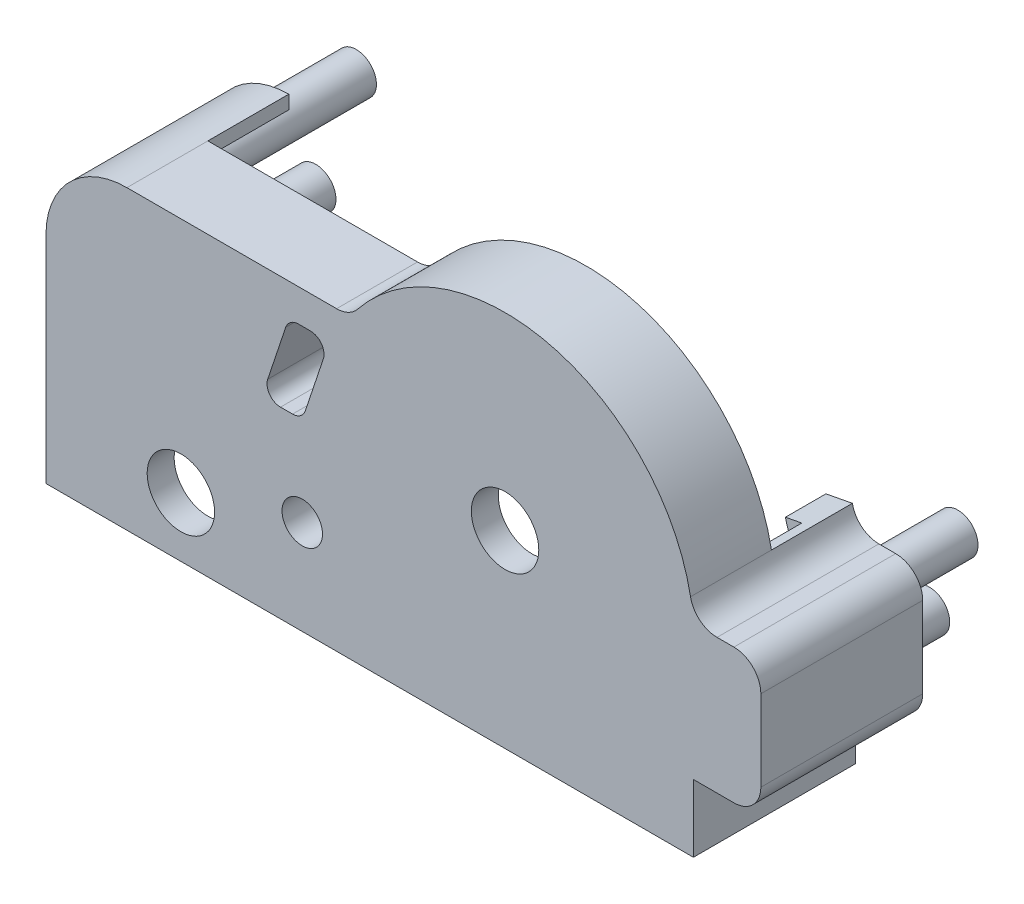
from build123d import *
from build123d.topology import SkipClean

# Parameters (mm, degrees)
BOSS_EXTRUDE1_DEPTH = 6
SHELL1_DEPTH        = 5
SKETCH2_R           = 1.25
SKETCH2_R_2         = 0.75
CUT_EXTRUDE1_DEPTH  = 6
SKETCH3_W           = 11.178272445
SKETCH3_H           = 3
BOSS_EXTRUDE2_DEPTH = 1
CUT_EXTRUDE2_DEPTH  = 3
BOSS_EXTRUDE4_START = 2
SKETCH7_R           = 7
SKETCH7_R_2         = 6
BOSS_EXTRUDE4_DEPTH = 2
BOSS_EXTRUDE5_START = 2
SKETCH8_R           = 1.55
SKETCH8_R_2         = 0.75
BOSS_EXTRUDE5_DEPTH = 2
SKETCH10_R          = 0.75
BOSS_EXTRUDE6_DEPTH = 8
SKETCH17_W          = 11.178272445
SKETCH17_H          = 1
CUT_EXTRUDE5_DEPTH  = 1
SKETCH18_W          = 2.5
SKETCH18_H          = 2
SKETCH18_W_2        = 2
SKETCH18_H_2        = 2.5
CUT_EXTRUDE7_DEPTH  = 3.5


# Read off the part's stored shape, not the designer's step: Shell1
with BuildPart() as part:
    # Sketch1 → Boss-Extrude1 (new body)
    with BuildSketch(Plane.XY):
        with BuildLine():
            Line((-17.017879978, -7), (6.982120022, -7))
            Line((6.982120022, -7), (6.982120022, -4.5))
            Line((6.982120022, -4.5), (8.482120022, -4.5))
            ThreePointArc((8.482120022, -4.5), (9.189226803, -4.207106781), (9.482120022, -3.5))
            Line((9.482120022, -3.5), (9.482120022, -0.5))
            ThreePointArc((9.482120022, -0.5), (9.189226803, 0.207106781), (8.482120022, 0.5))
            Line((8.482120022, 0.5), (7.858116823, 0.5))
            ThreePointArc((7.858116823, 0.5), (7.220739384, 0.72944825), (6.87585222, 1.3125))
            ThreePointArc((6.87585222, 1.3125), (1.68605895, 6.793909421), (-5.464373249, 4.375))
            ThreePointArc((-5.464373249, 4.375), (-5.811985297, 4.098612181), (-6.244997998, 4))
            Line((-6.244997998, 4), (-14.017879978, 4))
            ThreePointArc((-14.017879978, 4), (-16.139200322, 3.121320344), (-17.017879978, 1))
            Line((-17.017879978, 1), (-17.017879978, -7))
        make_face()
    extrude(amount=BOSS_EXTRUDE1_DEPTH)

    # Shell1 outline → Shell1 (cut)
    with BuildSketch(Plane.XY):
        with BuildLine():
            Line((-16.017879978, 1), (-16.017879978, -7))
            Line((-16.017879978, -7), (5.982120022, -7))
            Line((5.982120022, -7), (5.982120022, -3.5))
            Line((5.982120022, -3.5), (8.482120022, -3.5))
            Line((8.482120022, -3.5), (8.482120022, -0.5))
            Line((8.482120022, -0.5), (7.858116823, -0.5))
            ThreePointArc((7.858116823, -0.5), (6.583361944, -0.041103501), (5.893587617, 1.125))
            ThreePointArc((5.893587617, 1.125), (1.445193386, 5.823350932), (-4.683748499, 3.75))
            ThreePointArc((-4.683748499, 3.75), (-5.378972594, 3.197224362), (-6.244997998, 3))
            Line((-6.244997998, 3), (-14.017879978, 3))
            ThreePointArc((-14.017879978, 3), (-15.43209354, 2.414213562), (-16.017879978, 1))
        make_face()
    extrude(amount=SHELL1_DEPTH, mode=Mode.SUBTRACT)

    # Sketch2 → Cut-Extrude1 (cut)
    with BuildSketch(Plane(origin=(0, 0, 5), x_dir=(-1, 0, 0), z_dir=(0, 0, -1))):
        Circle(SKETCH2_R)
        with Locations((7.517879978, -3.5)):
            Circle(SKETCH2_R_2)
        with Locations((12.017879978, -4.796605976)):
            Circle(SKETCH2_R)
        with BuildLine():
            Line((7.211592921, 2.8), (7.657500368, 2.8))
            ThreePointArc((7.657500368, 2.8), (7.94985551, 2.705621093), (8.131842017, 2.458113883))
            Line((8.131842017, 2.458113883), (8.798508684, 0.458113883))
            ThreePointArc((8.798508684, 0.458113883), (8.729788127, 0.007644858), (8.324167035, -0.2))
            Line((8.324167035, -0.2), (7.878259588, -0.2))
            ThreePointArc((7.878259588, -0.2), (7.585904446, -0.105621093), (7.403917939, 0.141886117))
            Line((7.403917939, 0.141886117), (6.737251272, 2.141886117))
            ThreePointArc((6.737251272, 2.141886117), (6.805971829, 2.592355142), (7.211592921, 2.8))
        make_face()
    extrude(amount=-CUT_EXTRUDE1_DEPTH, mode=Mode.SUBTRACT)

    # Sketch3 → Boss-Extrude2 (add)
    with BuildSketch(Plane.XZ.offset(7)):
        with Locations((0.3929838, 3.5)):
            Rectangle(SKETCH3_W, SKETCH3_H)
    extrude(amount=-BOSS_EXTRUDE2_DEPTH)

    # Sketch6 → Cut-Extrude2 (cut)
    with BuildSketch(Plane(origin=(0, 0, 0), x_dir=(-1, 0, 0), z_dir=(0, 0, -1))):
        with BuildLine():
            Line((6.244997998, 4), (14.017879978, 4))
            Line((14.017879978, 4), (14.017879978, 3))
            Line((14.017879978, 3), (6.244997998, 3))
            ThreePointArc((6.244997998, 3), (5.378972595, 3.197224362), (4.683748499, 3.75))
            ThreePointArc((4.683748499, 3.75), (-1.445193386, 5.823350932), (-5.893587617, 1.125))
            Line((-5.893587617, 1.125), (-6.87585222, 1.3125))
            ThreePointArc((-6.87585222, 1.3125), (-1.68605895, 6.793909421), (5.464373249, 4.375))
            ThreePointArc((5.464373249, 4.375), (5.811985297, 4.098612181), (6.244997998, 4))
        make_face()
    extrude(amount=-CUT_EXTRUDE2_DEPTH, mode=Mode.SUBTRACT)

    # Sketch7 → Boss-Extrude4 (add)
    with SkipClean():  # the faces are left unmerged after this step: merging them gives an invalid solid
        with BuildSketch(Plane(origin=(0, 0, 5), x_dir=(-1, 0, 0), z_dir=(0, 0, -1)).offset(BOSS_EXTRUDE4_START)):
            Circle(SKETCH7_R)
            with Locations(Location((0, 0, 0), (0, 0, 270))):
                Circle(SKETCH7_R_2, mode=Mode.SUBTRACT)
        extrude(amount=-BOSS_EXTRUDE4_DEPTH)

    # Sketch8 → Boss-Extrude5 (add)
    # profile 1 of 2: a face of its own
    with SkipClean():  # the faces are left unmerged after this step: merging them gives an invalid solid
        with BuildSketch(Plane(origin=(0, 0, 5), x_dir=(-1, 0, 0), z_dir=(0, 0, -1)).offset(BOSS_EXTRUDE5_START)):
            with Locations((7.517879978, -3.5)):
                Circle(SKETCH8_R)
            with Locations((7.517879978, -3.5)):
                Circle(SKETCH8_R_2, mode=Mode.SUBTRACT)
        # profile 2 of 2: a face of its own
        with BuildSketch(Plane(origin=(0, 0, 5), x_dir=(-1, 0, 0), z_dir=(0, 0, -1)).offset(BOSS_EXTRUDE5_START)):
            with BuildLine():
                Line((5.978304634, 1.888903904), (6.644971301, -0.111096096))
                ThreePointArc((6.644971301, -0.111096096), (7.118136218, -0.754614841), (7.878259588, -1))
                Line((7.878259588, -1), (8.324167035, -1))
                ThreePointArc((8.324167035, -1), (9.378781875, -0.46012337), (9.557455322, 0.711096096))
                Line((9.557455322, 0.711096096), (8.890788656, 2.711096096))
                ThreePointArc((8.890788656, 2.711096096), (8.417623738, 3.354614841), (7.657500368, 3.6))
                Line((7.657500368, 3.6), (7.211592921, 3.6))
                ThreePointArc((7.211592921, 3.6), (6.156978081, 3.06012337), (5.978304634, 1.888903904))
            make_face()
            with BuildLine():
                Line((7.657500368, 2.8), (7.211592921, 2.8))
                ThreePointArc((7.211592921, 2.8), (6.805971829, 2.592355142), (6.737251272, 2.141886117))
                Line((6.737251272, 2.141886117), (7.403917939, 0.141886117))
                ThreePointArc((7.403917939, 0.141886117), (7.585904446, -0.105621093), (7.878259588, -0.2))
                Line((7.878259588, -0.2), (8.324167035, -0.2))
                ThreePointArc((8.324167035, -0.2), (8.729788127, 0.007644858), (8.798508684, 0.458113883))
                Line((8.798508684, 0.458113883), (8.131842017, 2.458113883))
                ThreePointArc((8.131842017, 2.458113883), (7.94985551, 2.705621093), (7.657500368, 2.8))
            make_face(mode=Mode.SUBTRACT)
        extrude(amount=-BOSS_EXTRUDE5_DEPTH)

    # Sketch10 → Boss-Extrude6 (add)
    with SkipClean():  # the faces are left unmerged after this step: merging them gives an invalid solid
        with BuildSketch(Plane(origin=(0, 0, 5), x_dir=(-1, 0, 0), z_dir=(0, 0, -1))):
            with Locations(Location((-7.782120022, -0.7, 0), (0, 0, 201.039469781))):
                Circle(SKETCH10_R)
            with Locations((-6.732120022, -3.7)):
                Circle(SKETCH10_R)
            with Locations(Location((16.017879978, -1.5, 0), (0, 0, 90))):
                Circle(SKETCH10_R)
            with Locations(Location((14.517879978, 2.936491673, 0), (0, 0, 175.1425044))):
                Circle(SKETCH10_R)
        extrude(amount=BOSS_EXTRUDE6_DEPTH)

    # Sketch17 → Cut-Extrude5 (cut)
    with SkipClean():  # the faces are left unmerged after this step: merging them gives an invalid solid
        with BuildSketch(Plane(origin=(0, 0, 2), x_dir=(-1, 0, 0), z_dir=(0, 0, -1))):
            with Locations((-0.3929838, -6.5)):
                Rectangle(SKETCH17_W, SKETCH17_H)
        extrude(amount=-CUT_EXTRUDE5_DEPTH, mode=Mode.SUBTRACT)

    # Sketch18 → Cut-Extrude7 (cut)
    with BuildSketch(Plane(origin=(0, 0, 5), x_dir=(-1, 0, 0), z_dir=(0, 0, -1))):
        Polygon((2.298097039, 4.065863992), (3.712310601, 5.480077554), (5.480077554, 3.712310601), (4.065863992, 2.298097039), align=None)
        with Locations((0, 5.5)):
            Rectangle(SKETCH18_W, SKETCH18_H)
        with Locations((5.5, 0)):
            Rectangle(SKETCH18_W_2, SKETCH18_H_2)
        Polygon((4.065863992, -2.298097039), (5.480077554, -3.712310601), (3.712310601, -5.480077554), (2.298097039, -4.065863992), align=None)
        with Locations((0, -5.5)):
            Rectangle(SKETCH18_W, SKETCH18_H)
        Polygon((-2.298097039, -4.065863992), (-3.712310601, -5.480077554), (-5.480077554, -3.712310601), (-4.065863992, -2.298097039), align=None)
        with Locations((-5.5, 0)):
            Rectangle(SKETCH18_W_2, SKETCH18_H_2)
        Polygon((-4.065863992, 2.298097039), (-5.480077554, 3.712310601), (-3.712310601, 5.480077554), (-2.298097039, 4.065863992), align=None)
    extrude(amount=CUT_EXTRUDE7_DEPTH, mode=Mode.SUBTRACT)


solid = part.part
